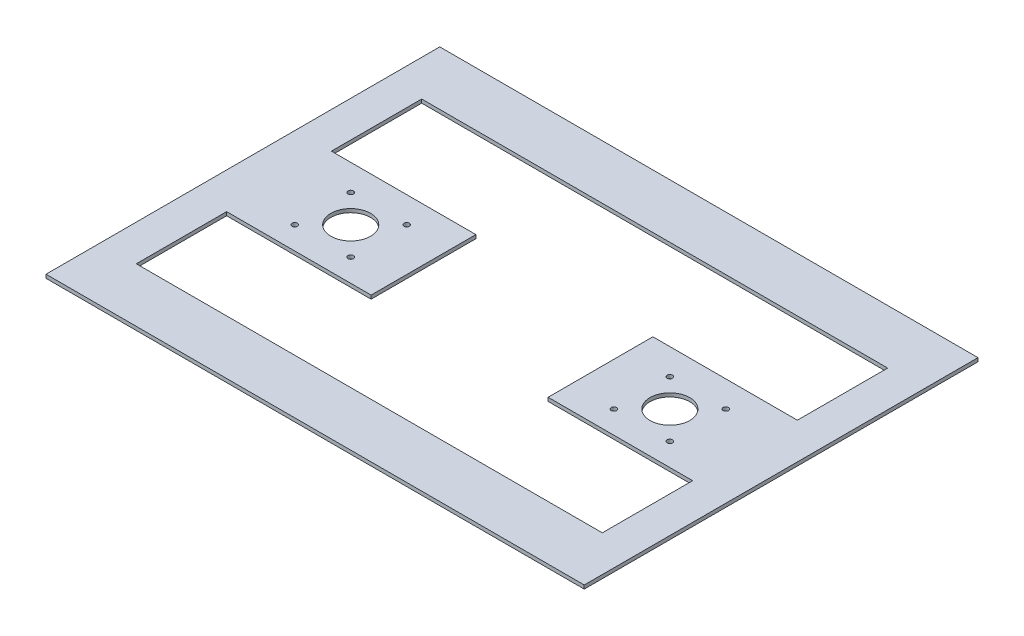
from build123d import *

# Parameters (mm, degrees)
SKETCH1_W           = 218
SKETCH1_H           = 2
BOSS_EXTRUDE1_DEPTH = 298
SKETCH2_R           = 11
SKETCH2_R_2         = 1.5
CUT_EXTRUDE1_DEPTH  = 10


with BuildPart() as part:
    # Sketch1 → Boss-Extrude1 (new body)
    with BuildSketch(Plane(origin=(0, 0, 0), x_dir=(0, 0, -1), z_dir=(1, 0, 0))):
        with Locations((82.3216851, 1)):
            Rectangle(SKETCH1_W, SKETCH1_H)
    extrude(amount=BOSS_EXTRUDE1_DEPTH)

    # Sketch2 → Cut-Extrude1 (cut)
    with BuildSketch(Plane(origin=(0, 2, 0), x_dir=(1, 0, 0), z_dir=(0, 1, 0))):
        with Locations((60.65043643, 81.376769982)):
            Circle(SKETCH2_R)
        with Locations((76.15043643, 65.876769982)):
            Circle(SKETCH2_R_2)
        with Locations((45.15043643, 65.876769982)):
            Circle(SKETCH2_R_2)
        with Locations((76.15043643, 96.876769982)):
            Circle(SKETCH2_R_2)
        with Locations((45.15043643, 96.876769982)):
            Circle(SKETCH2_R_2)
        with Locations((252.84956357, 65.876769982)):
            Circle(SKETCH2_R_2)
        with Locations((221.84956357, 65.876769982)):
            Circle(SKETCH2_R_2)
        with Locations((221.84956357, 96.876769982)):
            Circle(SKETCH2_R_2)
        with Locations((252.84956357, 96.876769982)):
            Circle(SKETCH2_R_2)
        with Locations((237.34956357, 81.376769982)):
            Circle(SKETCH2_R)
        Polygon((20, 161.3216851), (278, 161.3216851), (278, 111.3216851), (198, 111.3216851), (198, 53.3216851), (278, 53.3216851), (278, 3.3216851), (20, 3.3216851), (20, 53.3216851), (100, 53.3216851), (100, 111.3216851), (20, 111.3216851), align=None)
    extrude(amount=-CUT_EXTRUDE1_DEPTH, mode=Mode.SUBTRACT)


solid = part.part
